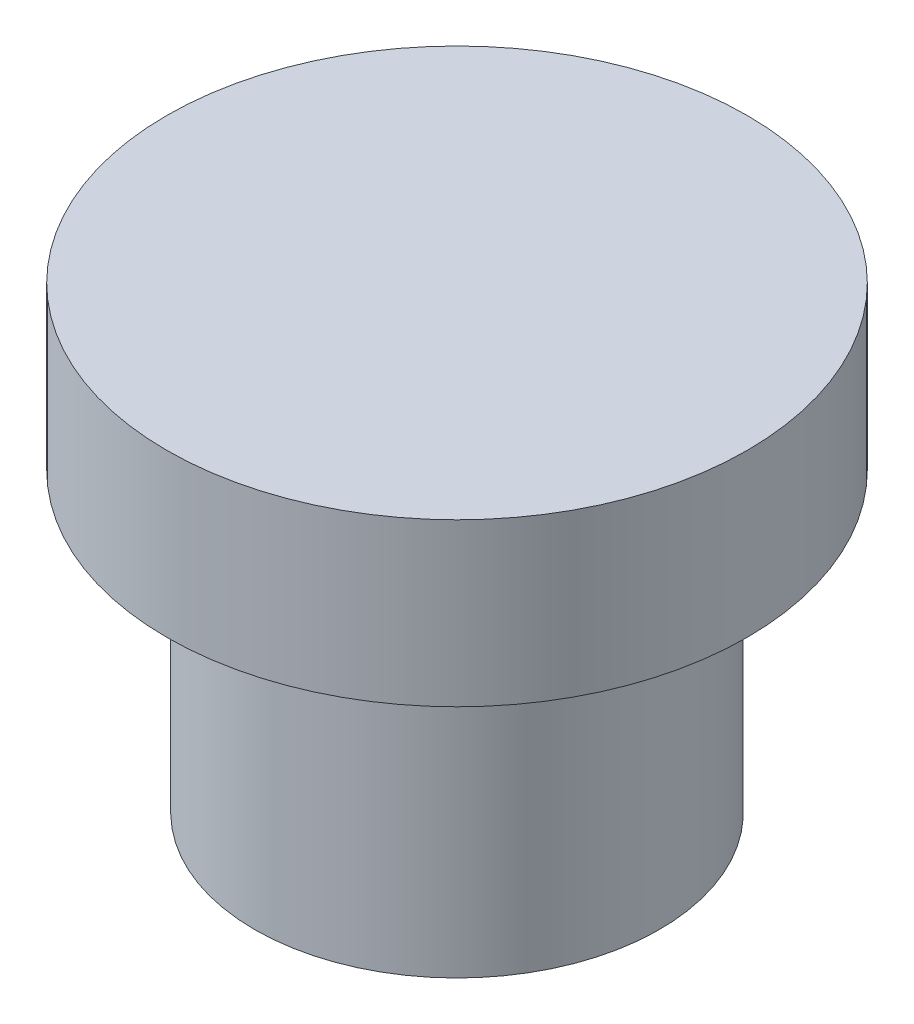
from build123d import *

# Parameters (mm, degrees)
SKETCH1_R           = 7.5
BOSS_EXTRUDE1_DEPTH = 11
SKETCH2_R           = 10.75
BOSS_EXTRUDE2_DEPTH = 6


with BuildPart() as part:
    # Sketch1 → Boss-Extrude1 (new body)
    with BuildSketch(Plane(origin=(0, 0, 0), x_dir=(1, 0, 0), z_dir=(0, 1, 0))):
        Circle(SKETCH1_R)
    extrude(amount=BOSS_EXTRUDE1_DEPTH)

    # Sketch2 → Boss-Extrude2 (add)
    with BuildSketch(Plane(origin=(0, 11, 0), x_dir=(1, 0, 0), z_dir=(0, 1, 0))):
        Circle(SKETCH2_R)
    extrude(amount=BOSS_EXTRUDE2_DEPTH)


solid = part.part
